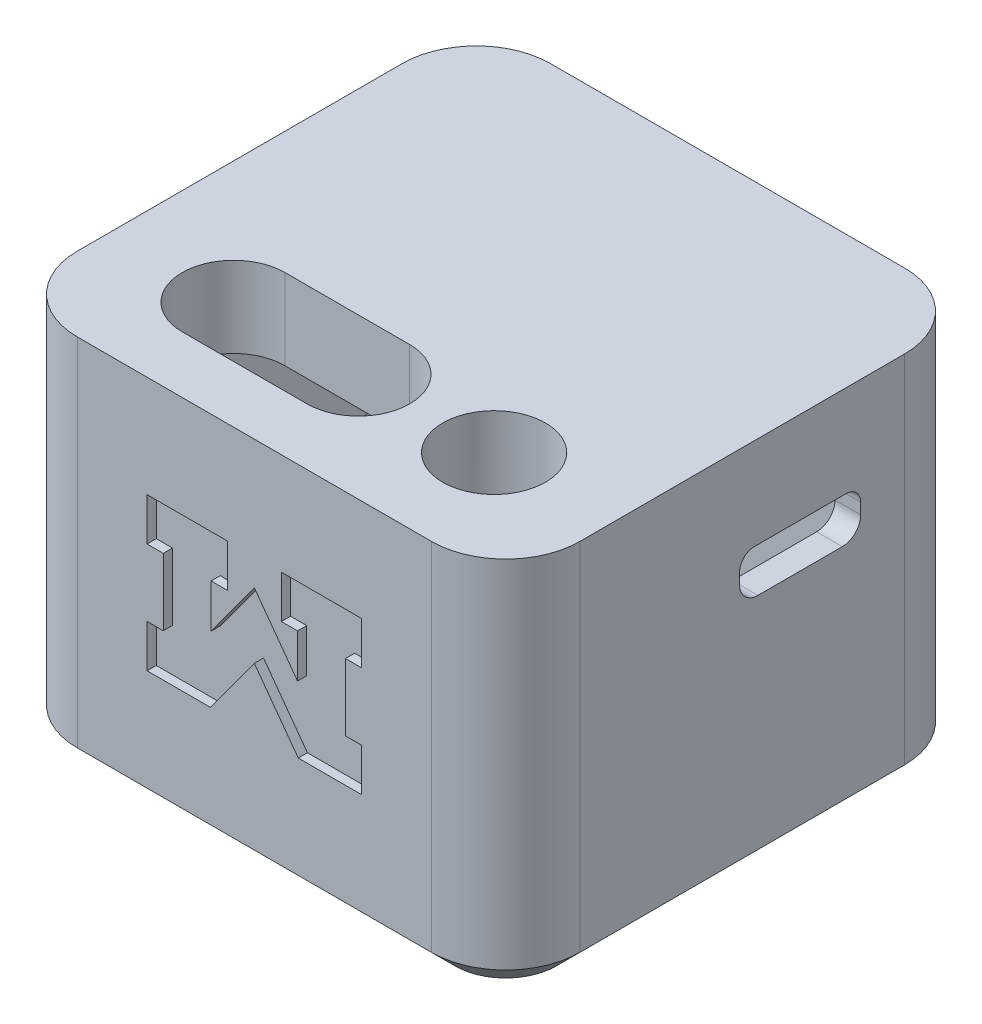
from build123d import *

# Parameters (mm, degrees)
BOSS_EXTRUDE1_DEPTH = 1.778
BOSS_EXTRUDE2_DEPTH = 22.86
SKETCH5_R           = 3.556
SKETCH5_W           = 15.748
SKETCH5_H           = 7.112
CUT_EXTRUDE1_DEPTH  = 1.778
FILLET1_R           = 3.556
CUT_EXTRUDE2_DEPTH  = 12.7
CUT_EXTRUDE3_DEPTH  = 12.7
SKETCH9_R           = 3.556
BOSS_EXTRUDE3_DEPTH = 3.81
CUT_EXTRUDE4_DEPTH  = 0.635


with BuildPart() as part:
    # Sketch1 → Boss-Extrude1 (new body)
    with BuildSketch(Plane(origin=(0, 0, 0), x_dir=(1, 0, 0), z_dir=(0, 1, 0))):
        with BuildLine():
            Line((-1.778, 3.3655), (-1.778, 25.8445))
            ThreePointArc((-1.778, 25.8445), (-0.271503729, 29.481503729), (3.3655, 30.988))
            Line((3.3655, 30.988), (27.8765, 30.988))
            ThreePointArc((27.8765, 30.988), (31.513503729, 29.481503729), (33.02, 25.8445))
            Line((33.02, 25.8445), (33.02, 3.3655))
            ThreePointArc((33.02, 3.3655), (31.513503729, -0.271503729), (27.8765, -1.778))
            Line((27.8765, -1.778), (3.3655, -1.778))
            ThreePointArc((3.3655, -1.778), (-0.271503729, -0.271503729), (-1.778, 3.3655))
        make_face()
    extrude(amount=-BOSS_EXTRUDE1_DEPTH)

    # Sketch3 → Boss-Extrude2 (add)
    with BuildSketch(Plane.XZ.offset(1.778)):
        with BuildLine():
            Line((27.8765, 1.778), (3.3655, 1.778))
            ThreePointArc((3.3655, 1.778), (-0.271503729, 0.271503729), (-1.778, -3.3655))
            Line((-1.778, -3.3655), (-1.778, -25.8445))
            ThreePointArc((-1.778, -25.8445), (-0.271503729, -29.481503729), (3.3655, -30.988))
            Line((3.3655, -30.988), (27.8765, -30.988))
            ThreePointArc((27.8765, -30.988), (31.513503729, -29.481503729), (33.02, -25.8445))
            Line((33.02, -25.8445), (33.02, -3.3655))
            ThreePointArc((33.02, -3.3655), (31.513503729, 0.271503729), (27.8765, 1.778))
        make_face()
        with BuildLine():
            Line((0, -3.3655), (0, -25.8445))
            ThreePointArc((0, -25.8445), (0.985732128, -28.224267872), (3.3655, -29.21))
            Line((3.3655, -29.21), (27.8765, -29.21))
            ThreePointArc((27.8765, -29.21), (30.256267872, -28.224267872), (31.242, -25.8445))
            Line((31.242, -25.8445), (31.242, -3.3655))
            ThreePointArc((31.242, -3.3655), (30.256267872, -0.985732128), (27.8765, 0))
            Line((27.8765, 0), (3.3655, 0))
            ThreePointArc((3.3655, 0), (0.985732128, -0.985732128), (0, -3.3655))
        make_face(mode=Mode.SUBTRACT)
    extrude(amount=BOSS_EXTRUDE2_DEPTH)

    # Sketch5 → Cut-Extrude1 (cut)
    with BuildSketch(Plane(origin=(0, 0, 0), x_dir=(1, 0, 0), z_dir=(0, 1, 0))):
        with Locations(Location((24.7269, 5.715, 0), (0, 0, 270))):
            Circle(SKETCH5_R)
        with Locations((11.0109, 5.715)):
            Rectangle(SKETCH5_W, SKETCH5_H)
    extrude(amount=-CUT_EXTRUDE1_DEPTH, mode=Mode.SUBTRACT)

    # Fillet1
    fillet1_edges = [part.edges().sort_by_distance(p)[0] for p in [
        (3.1369, -0.889, -2.159),
        (18.8849, -0.889, -2.159),
        (18.8849, -0.889, -9.271),
        (3.1369, -0.889, -9.271),
    ]]
    fillet(fillet1_edges, radius=FILLET1_R - 0.0001)  # a hair under: the kernel refuses the full size

    # Sketch6 → Cut-Extrude2 (cut)
    with BuildSketch(Plane.ZY.offset(1.778)):
        with BuildLine():
            Line((-11.557, -1.778), (-24.511, -1.778))
            ThreePointArc((-24.511, -1.778), (-25.049815367, -2.001184633), (-25.273, -2.54))
            Line((-25.273, -2.54), (-25.273, -8.128))
            ThreePointArc((-25.273, -8.128), (-25.049815367, -8.666815367), (-24.511, -8.89))
            Line((-24.511, -8.89), (-11.557, -8.89))
            ThreePointArc((-11.557, -8.89), (-11.018184633, -8.666815367), (-10.795, -8.128))
            Line((-10.795, -8.128), (-10.795, -2.54))
            ThreePointArc((-10.795, -2.54), (-11.018184633, -2.001184633), (-11.557, -1.778))
        make_face()
    extrude(amount=-CUT_EXTRUDE2_DEPTH, mode=Mode.SUBTRACT)

    # Sketch7 → Cut-Extrude3 (cut)
    with BuildSketch(Plane(origin=(0, 0, -30.988), x_dir=(-1, 0, 0), z_dir=(0, 0, -1))):
        with BuildLine():
            Line((-23.8125889, -6.35), (-17.4625889, -6.35))
            ThreePointArc((-17.4625889, -6.35), (-16.74416841, -6.64757951), (-16.4465889, -7.366))
            Line((-16.4465889, -7.366), (-16.4465889, -8.128))
            ThreePointArc((-16.4465889, -8.128), (-16.818563288, -9.026025612), (-17.7165889, -9.398))
            Line((-17.7165889, -9.398), (-23.5585889, -9.398))
            ThreePointArc((-23.5585889, -9.398), (-24.456614512, -9.026025612), (-24.8285889, -8.128))
            Line((-24.8285889, -8.128), (-24.8285889, -7.366))
            ThreePointArc((-24.8285889, -7.366), (-24.53100939, -6.64757951), (-23.8125889, -6.35))
        make_face()
    cut_extrude3 = extrude(amount=-CUT_EXTRUDE3_DEPTH, mode=Mode.SUBTRACT)

    # Mirror1: Cut-Extrude3 across plane
    add(cut_extrude3.mirror(Plane(origin=(1.016, 0, 1.016), x_dir=(-0.7071067811865437, 0, 0.7071067811865512), z_dir=(-0.7071067811865512, 0, -0.7071067811865438))), mode=Mode.SUBTRACT)

    # Sketch9 → Boss-Extrude3 (add)
    with BuildSketch(Plane.XZ.offset(1.778)):
        with BuildLine():
            Line((6.6929, -10.541), (15.3289, -10.541))
            ThreePointArc((15.3289, -10.541), (18.327432056, -9.496412634), (20.0279, -6.814852263))
            ThreePointArc((20.0279, -6.814852263), (29.5529, -5.715), (20.0279, -4.615147737))
            ThreePointArc((20.0279, -4.615147737), (18.327432056, -1.933587366), (15.3289, -0.889))
            Line((15.3289, -0.889), (6.6929, -0.889))
            ThreePointArc((6.6929, -0.889), (3.280402674, -2.302502674), (1.8669, -5.715))
            ThreePointArc((1.8669, -5.715), (3.280402674, -9.127497326), (6.6929, -10.541))
        make_face()
        with Locations(Location((24.7269, -5.715, 0), (0, 0, 90))):
            Circle(SKETCH9_R, mode=Mode.SUBTRACT)
        with BuildLine():
            Line((6.6929, -9.271), (15.3289, -9.271))
            ThreePointArc((15.3289, -9.271), (17.843371714, -8.229471714), (18.8849, -5.715))
            ThreePointArc((18.8849, -5.715), (17.843371714, -3.200528286), (15.3289, -2.159))
            Line((15.3289, -2.159), (6.6929, -2.159))
            ThreePointArc((6.6929, -2.159), (4.178428286, -3.200528286), (3.1369, -5.715))
            ThreePointArc((3.1369, -5.715), (4.178428286, -8.229471714), (6.6929, -9.271))
        make_face(mode=Mode.SUBTRACT)
    extrude(amount=BOSS_EXTRUDE3_DEPTH)

    # Sweep1: sweep along a path in Sketch12
    with BuildLine(Plane.XZ.offset(24.638)) as sweep1_path:
        Line((31.242, -25.8445), (31.242, -3.3655))
        ThreePointArc((31.242, -3.3655), (30.256267872, -0.985732128), (27.8765, 0))
        Line((27.8765, 0), (3.3655, 0))
        ThreePointArc((3.3655, 0), (0.985732128, -0.985732128), (0, -3.3655))
        Line((0, -3.3655), (0, -25.8445))
        ThreePointArc((0, -25.8445), (0.985732128, -28.224267872), (3.3655, -29.21))
        Line((3.3655, -29.21), (27.8765, -29.21))
        ThreePointArc((27.8765, -29.21), (30.256267872, -28.224267872), (31.242, -25.8445))
    # Sketch11 → Sweep1 (sweep)
    with BuildSketch(Plane(origin=(0, 0, -9.652), x_dir=(-1, 0, 0), z_dir=(0, 0, -1))):
        Polygon((1.778, -24.638), (0, -24.638), (0.143040428, -26.272959572), align=None)
    sweep(path=sweep1_path.line)

    # Sweep2: sweep along a path in Sketch14
    with BuildLine(Plane(origin=(0, -19.812, 0), x_dir=(-1, 0, 0), z_dir=(0, -1, 0))) as sweep2_path:
        Line((-13.282231977, 29.21), (-3.3655, 29.21))
        ThreePointArc((-3.3655, 29.21), (-0.985732128, 28.224267872), (0, 25.8445))
        Line((0, 25.8445), (0, 3.3655))
        ThreePointArc((0, 3.3655), (-0.985732128, 0.985732128), (-3.3655, 0))
        Line((-3.3655, 0), (-27.8765, 0))
        ThreePointArc((-27.8765, 0), (-30.256267872, 0.985732128), (-31.242, 3.3655))
        Line((-31.242, 3.3655), (-31.242, 11.366960451))
    # Sketch15 → Sweep2 (sweep)
    with BuildSketch(Plane(origin=(13.282231977, 0, 0), x_dir=(0, 0, -1), z_dir=(1, 0, 0))):
        Polygon((29.21, -19.812), (29.21, -18.034), (28.448, -18.796), (28.448, -19.812), align=None)
    sweep(path=sweep2_path.line)

    # Sketch16 → Cut-Extrude4 (cut)
    with BuildSketch(Plane.XY.offset(1.778)):
        Polygon((23.045, -17.599), (23.045, -14.639), (21.925, -14.639), (21.925, -9.999), (23.045, -9.999), (23.045, -7.039), (17.493, -7.039), (17.493, -9.999), (18.613, -9.999), (18.613, -13.007), (15.621, -8.912684211), (12.629, -13.007), (12.629, -9.999), (13.749, -9.999), (13.749, -7.039), (8.197, -7.039), (8.197, -9.999), (9.317, -9.999), (9.317, -14.639), (8.197, -14.639), (8.197, -17.599), (12.581, -17.599), (15.621, -13.439), (18.661, -17.599), align=None)
    extrude(amount=-CUT_EXTRUDE4_DEPTH, mode=Mode.SUBTRACT)


solid = part.part
